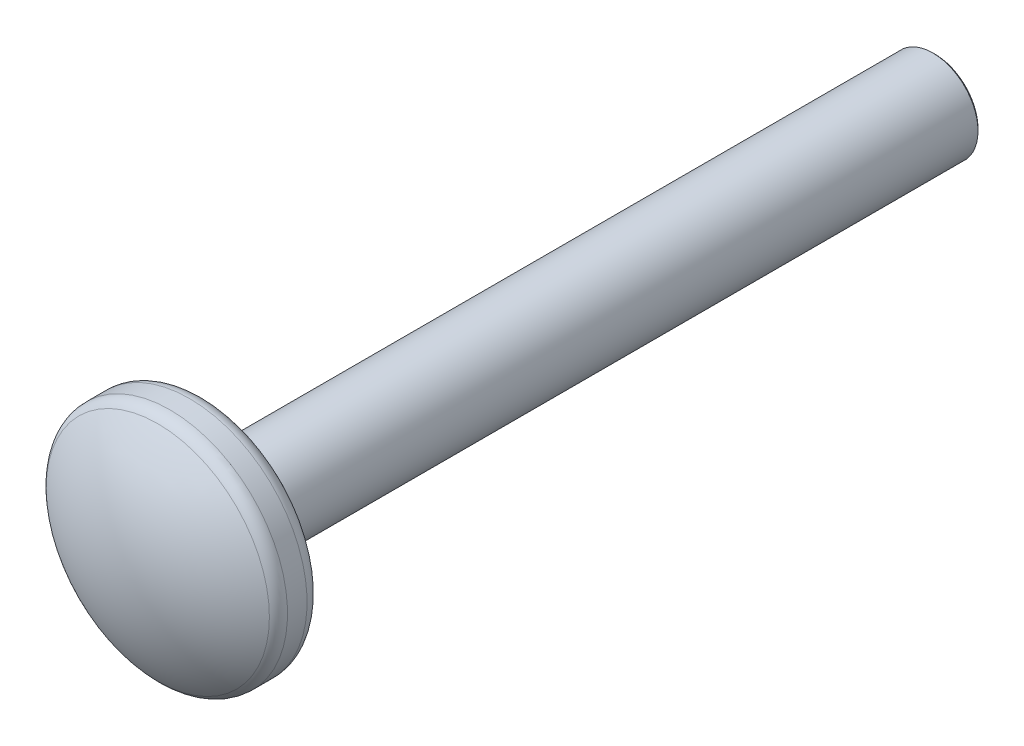
from build123d import *

# Parameters (mm, degrees)
SKETCH3_W          = 25.4
SKETCH3_H          = 1.567244252
SKETCH38_OUTSIDE_W = 63.284
SKETCH38_OUTSIDE_H = 63.284
SKETCH38_OUTSIDE_R = 1.4874875
EXTRUDE6_DEPTH     = 26.496519549
EXTRUDE6_DRAFT     = -45
SKETCH8_W          = 2.921
SKETCH8_H          = 4.0894
SKETCH21_R         = 2.690784338
SKETCH21_R_2       = 1.567244252
EXTRUDE2_DEPTH     = 0.5842


with BuildPart() as part:
    # Sketch3 → Revolve1 (revolve)
    with BuildSketch(Plane(origin=(0, 0, 0), x_dir=(0, 0, -1), z_dir=(1, 0, 0))):
        with Locations((-12.7, 0.783622126)):
            Rectangle(SKETCH3_W, SKETCH3_H)
    revolve(axis=Axis((0, 0, 0), (0, 0, 1)))


with BuildPart() as extrude6_tool:
    # Sketch38 outside → Extrude6 (with draft: the straight prism first)
    with BuildSketch(Plane(origin=(0, 0, 0), x_dir=(-1, 0, 0), z_dir=(0, 0, -1))):
        Rectangle(SKETCH38_OUTSIDE_W, SKETCH38_OUTSIDE_H)
        Circle(SKETCH38_OUTSIDE_R, mode=Mode.SUBTRACT)
    extrude(amount=-EXTRUDE6_DEPTH)
    # Extrude6: the draft: its side faces are tilted about the plane it starts from
    extrude6_sides = [extrude6_tool.faces().sort_by_distance(p)[0] for p in [
        (0, -31.642, 13.248259774),
        (-31.642, 0, 13.248259774),
        (0, 31.642, 13.248259774),
        (31.642, 0, 13.248259774),
        (1.4874875, 0, 13.248259774),
    ]]
    draft(extrude6_sides, Plane(origin=(0, 0, 0), x_dir=(-1, 0, 0), z_dir=(0, 0, -1)), EXTRUDE6_DRAFT)


with BuildPart() as part_1:
    add(part.part)

    # Extrude6: cut by extrude6_tool
    add(extrude6_tool.part, mode=Mode.SUBTRACT)

    # Sketch8 → Revolve2 (revolve)
    with BuildSketch(Plane(origin=(0, 0, 0), x_dir=(0, 0, -1), z_dir=(1, 0, 0))):
        with Locations((-26.8605, 2.0447)):
            Rectangle(SKETCH8_W, SKETCH8_H)
    revolve(axis=Axis((0, 0, 0), (0, 0, 1)))

    # Sketch11 → Cut-Revolve3 (revolve, cut)
    with BuildSketch(Plane(origin=(0, 0, 0), x_dir=(0, 0, -1), z_dir=(1, 0, 0))):
        with BuildLine():
            Line((-26.604906874, 4.0894), (-25.92578, 4.0894))
            ThreePointArc((-25.92578, 4.0894), (-25.553997397, 3.935402603), (-25.4, 3.56362))
            Line((-25.4, 3.56362), (-24.765, 3.56362))
            Line((-24.765, 3.56362), (-24.765, 4.7244))
            Line((-24.765, 4.7244), (-28.956, 4.7244))
            Line((-28.956, 4.7244), (-28.956, 0))
            Line((-28.956, 0), (-28.321, 0))
            ThreePointArc((-28.321, 0), (-27.988470898, 2.045152261), (-27.025141868, 3.87960601))
            ThreePointArc((-27.025141868, 3.87960601), (-26.839753083, 4.034036694), (-26.604906874, 4.0894))
        make_face()
    revolve(axis=Axis((0, 0, 28.321), (0, 0, -1)), mode=Mode.SUBTRACT)


with BuildPart() as body_2:
    # Sketch21 → Extrude2 (new body)
    with BuildSketch(Plane.XY.offset(25.243869553)):
        Circle(SKETCH21_R)
        Circle(SKETCH21_R_2, mode=Mode.SUBTRACT)
    extrude(amount=-EXTRUDE2_DEPTH)


solid = Compound([part_1.part, body_2.part])
